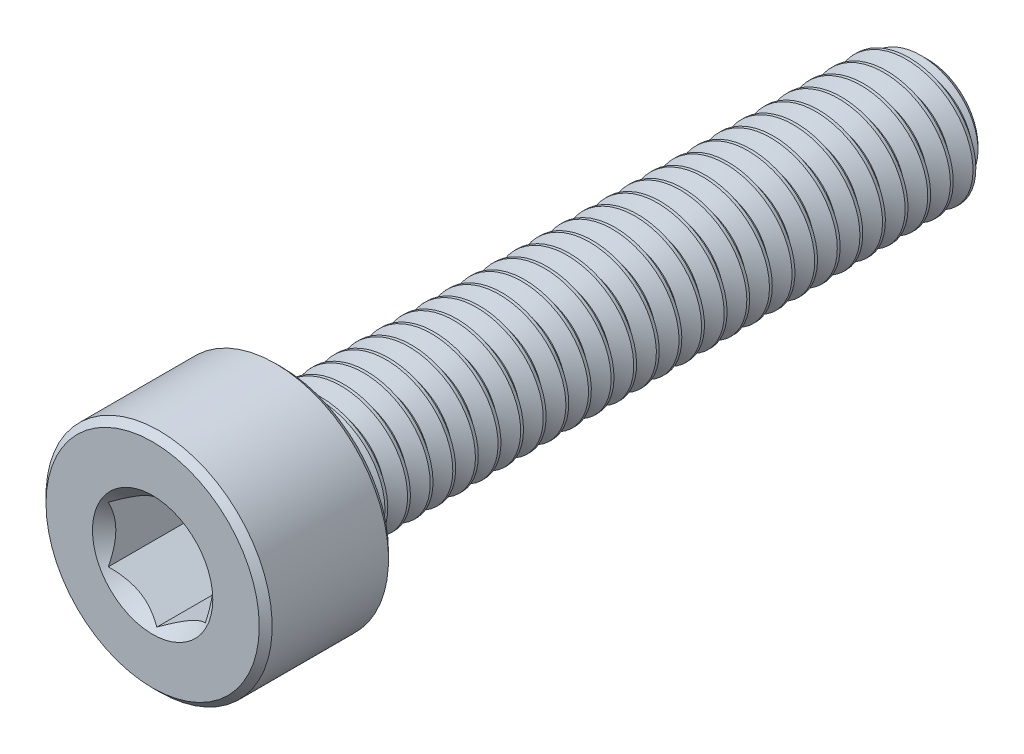
from build123d import *

# Parameters (mm, degrees)
CUT_EXTRUDE1_DEPTH     = 3
SPLIT1_SURFACE_1_BACK  = 26.962
SPLIT1_SURFACE_1_DEPTH = 53.924
SPLIT1_SURFACE_2_BACK  = 26.962
SPLIT1_SURFACE_2_DEPTH = 53.924
CUT_SWEEP1_PITCH       = 0.7


with BuildPart() as part:
    # Sketch2 → Revolve1 (revolve)
    with BuildSketch(Plane(origin=(0, 0, 0), x_dir=(0, 0, -1), z_dir=(1, 0, 0))):
        with BuildLine():
            Line((-12, 0), (-12, 3.3))
            Line((-12, 3.3), (-11.8, 3.5))
            Line((-11.8, 3.5), (-8.2, 3.5))
            Line((-8.2, 3.5), (-8, 3.3))
            Line((-8, 3.3), (-8, 2.2))
            ThreePointArc((-8, 2.2), (-7.941421356, 2.058578644), (-7.8, 2))
            Line((-7.8, 2), (11.545336663, 2))
            Line((11.545336663, 2), (12, 1.545336663))
            Line((12, 1.545336663), (12, 0))
            Line((12, 0), (-12, 0))
        make_face()
    revolve(axis=Axis((0, 0, -12), (0, 0, 1)))

    # Sketch3 → Cut-Extrude1 (cut)
    with BuildSketch(Plane.XY.offset(12)):
        Polygon((1.5, -0.866025404), (1.5, 0.866025404), (0, 1.732050808), (-1.5, 0.866025404), (-1.5, -0.866025404), (0, -1.732050808), align=None)
    extrude(amount=-CUT_EXTRUDE1_DEPTH, mode=Mode.SUBTRACT)

    # Cut-Extrude2 cone 1 section (through the dimple's axis) → Cut-Extrude2 (revolve, cut)
    with BuildSketch(Plane(origin=(0, 0, 12), x_dir=(0, -1, 0), z_dir=(1, 0, 0))):
        Polygon((0, 0), (1.861954618, 0), (0, 1.861954618), align=None)
    revolve(axis=Axis((0, 0, 12), (0, 0, -1)), mode=Mode.SUBTRACT)


with BuildPart() as body_2:
    # Split1: the piece behind the surface
    add(part.part)
    # Split1 surface: a surface, the sketch's curves swept straight by 53.924 mm
    with BuildLine(Plane(origin=(0, 0, 0), x_dir=(0, 0, -1), z_dir=(1, 0, 0)).offset(-SPLIT1_SURFACE_1_BACK), mode=Mode.PRIVATE) as split1_surface_1_path:
        Line((-7.8, -3.5), (-7.8, 3.5))
    split1_surface_1 = Shell.extrude(split1_surface_1_path.wire(), (1 * SPLIT1_SURFACE_1_DEPTH, 0 * SPLIT1_SURFACE_1_DEPTH, 0 * SPLIT1_SURFACE_1_DEPTH))
    split(bisect_by=split1_surface_1, keep=Keep.BOTTOM)

    # Cut-Sweep1: the profile of Sketch7 screwed along a right-hand helix of 29.571429 turns, 6 arcs to a turn; built about Z, then put on its axis
    cut_sweep1_z = Axis((0, 0, 0), (0, 0, 1))
    cut_sweep1_corners = [(2.037888611, 0, 0.021875), (2.037888611, 0, -0.634375), (1.545336663, 0, -0.35), (1.545336663, 0, -0.2625)]
    with BuildLine(mode=Mode.PRIVATE) as cut_sweep1_profile:
        Line(cut_sweep1_corners[0], cut_sweep1_corners[1])
        Line(cut_sweep1_corners[1], cut_sweep1_corners[2])
        Line(cut_sweep1_corners[2], cut_sweep1_corners[3])
        Line(cut_sweep1_corners[3], cut_sweep1_corners[0])
    cut_sweep1_cap = Face(cut_sweep1_profile.wire())
    cut_sweep1_turn_angles = [0, 30, 60, 90, 120, 150, 180, 210, 240, 270, 300, 330, 360]
    cut_sweep1_turn_weights = [1, 0.8660254037844387, 1, 0.8660254037844387, 1, 0.8660254037844387, 1, 0.8660254037844387, 1, 0.8660254037844387, 1, 0.8660254037844387, 1]
    cut_sweep1_turn_rails = [Edge.make_bspline([Vector(p[0], p[1], 0).rotate(cut_sweep1_z, cut_sweep1_turn_angles[k]) / cut_sweep1_turn_weights[k] + Vector(0, 0, p[2] + CUT_SWEEP1_PITCH * cut_sweep1_turn_angles[k] / 360) for k in range(13)], [0, 0, 0, 1, 1, 2, 2, 3, 3, 4, 4, 5, 5, 6, 6, 6], 2, cut_sweep1_turn_weights) for p in cut_sweep1_corners]
    cut_sweep1_turn_sides = [Face.make_surface_from_curves(cut_sweep1_turn_rails[p[0]], cut_sweep1_turn_rails[p[1]]) for p in [(0, 1), (1, 2), (2, 3), (3, 0)]]
    cut_sweep1_last_angles = [10440, 10470, 10500, 10530, 10560, 10590, 10620, 10632.857142857, 10645.714285714]
    cut_sweep1_last_weights = [1, 0.8660254037844387, 1, 0.8660254037844387, 1, 0.8660254037844387, 1, 0.9749279121817342, 1]
    cut_sweep1_last_rails = [Edge.make_bspline([Vector(p[0], p[1], 0).rotate(cut_sweep1_z, cut_sweep1_last_angles[k]) / cut_sweep1_last_weights[k] + Vector(0, 0, p[2] + CUT_SWEEP1_PITCH * cut_sweep1_last_angles[k] / 360) for k in range(9)], [0, 0, 0, 1, 1, 2, 2, 3, 3, 4, 4, 4], 2, cut_sweep1_last_weights) for p in cut_sweep1_corners]
    cut_sweep1_last_sides = [Face.make_surface_from_curves(cut_sweep1_last_rails[p[0]], cut_sweep1_last_rails[p[1]]) for p in [(0, 1), (1, 2), (2, 3), (3, 0)]]
    cut_sweep1 = Plane(origin=(0, 0, -12), x_dir=(0, 1, 0), z_dir=(0, 0, 1)) * Solid(Shell([*[p.moved(Location((0, 0, CUT_SWEEP1_PITCH * i))) for i in range(29) for p in cut_sweep1_turn_sides], *cut_sweep1_last_sides, cut_sweep1_cap, cut_sweep1_cap.rotate(cut_sweep1_z, 10645.714285714).moved(Location((0, 0, CUT_SWEEP1_PITCH * 10645.714285714 / 360)))]))
    add(cut_sweep1, mode=Mode.SUBTRACT)


with BuildPart() as part_1:
    add(part.part)

    # Split1: split by a surface, the side it looks to stays
    # Split1 surface: a surface, the sketch's curves swept straight by 53.924 mm
    with BuildLine(Plane(origin=(0, 0, 0), x_dir=(0, 0, -1), z_dir=(1, 0, 0)).offset(-SPLIT1_SURFACE_2_BACK), mode=Mode.PRIVATE) as split1_surface_2_path:
        Line((-7.8, -3.5), (-7.8, 3.5))
    split1_surface_2 = Shell.extrude(split1_surface_2_path.wire(), (1 * SPLIT1_SURFACE_2_DEPTH, 0 * SPLIT1_SURFACE_2_DEPTH, 0 * SPLIT1_SURFACE_2_DEPTH))
    split(bisect_by=split1_surface_2, keep=Keep.TOP)

    add(body_2.part)  # Revolve2 merges body 2
    # Sketch8 → Revolve2 (revolve)
    with BuildSketch(Plane(origin=(0, 0, 0), x_dir=(0, 0, -1), z_dir=(1, 0, 0)), mode=Mode.PRIVATE) as revolve2_sk:
        Polygon((-8, 0), (-8, 2), (-7.8, 2), (-6.645299462, 0), align=None)
    revolve(revolve2_sk.sketch.rotate(Axis((0, 0, 6.645299462), (0, 0, 1)), 270), axis=Axis((0, 0, 6.645299462), (0, 0, 1)))


solid = part_1.part
